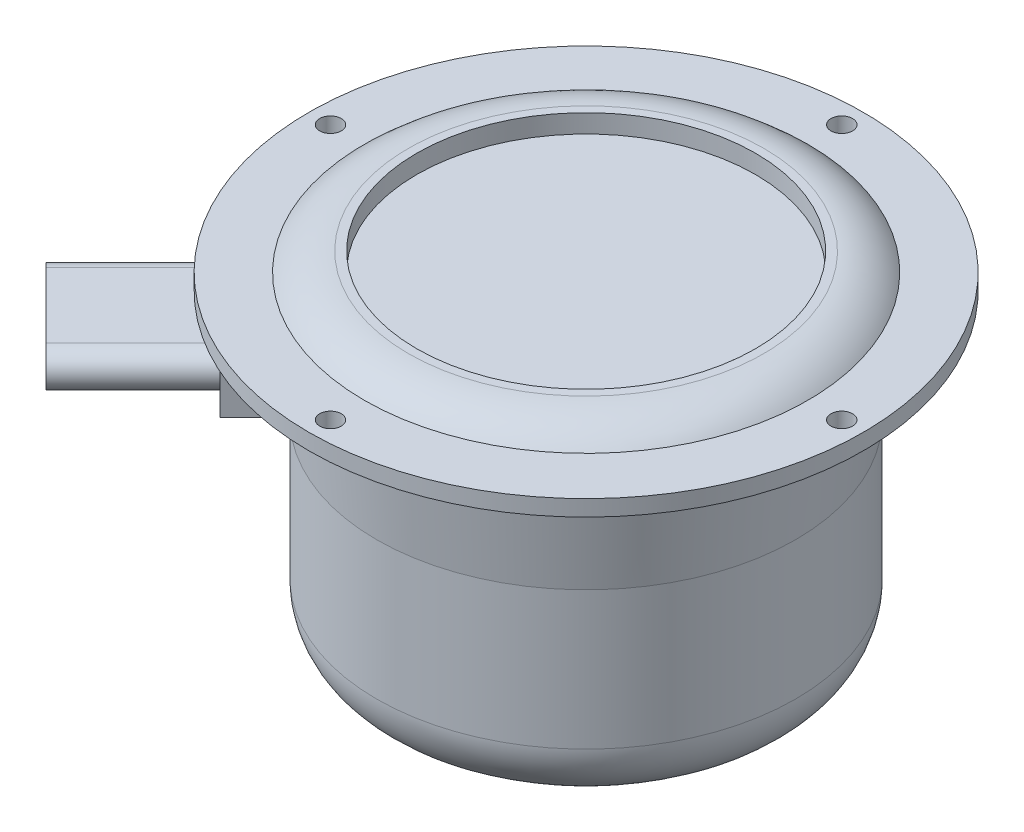
from build123d import *

# Parameters (mm, degrees)
SKETCH_1_R      = 45
SKETCH_1_R_2    = 1.75
EXTRUDE_1_DEPTH = 2.6
SKETCH_3_R      = 34
SKETCH_2_R      = 35.5
SKETCH_4_R      = 34
EXTRUDE_2_DEPTH = 32.4
FILLET_1_R      = 10
EXTRUDE_3_DEPTH = 10
EXTRUDE_4_DEPTH = 20
SKETCH_7_R      = 36
SKETCH_7_R_2    = 27.5
EXTRUDE_5_DEPTH = 3
FILLET_2_R      = 10


with BuildPart() as part:
    # 草图1 → 凸台-拉伸1 (new body)
    with BuildSketch(Plane(origin=(0, 0, 0), x_dir=(1, 0, 0), z_dir=(0, 1, 0))):
        with Locations(Location((0, 0, 0), (0, 0, 270))):
            Circle(SKETCH_1_R)
        with Locations(Location((41.5, 0, 0), (0, 0, 270))):
            Circle(SKETCH_1_R_2, mode=Mode.SUBTRACT)
        with Locations(Location((-41.5, 0, 0), (0, 0, 270))):
            Circle(SKETCH_1_R_2, mode=Mode.SUBTRACT)
        with Locations(Location((0, 41.5, 0), (0, 0, 270))):
            Circle(SKETCH_1_R_2, mode=Mode.SUBTRACT)
        with Locations(Location((0, -41.5, 0), (0, 0, 270))):
            Circle(SKETCH_1_R_2, mode=Mode.SUBTRACT)
    extrude(amount=EXTRUDE_1_DEPTH)

    # 草图3 → 放样1 section 0
    with BuildSketch(Plane(origin=(0, -18, 0), x_dir=(-1, 0, 0), z_dir=(0, -1, 0))):
        Circle(SKETCH_3_R)
    # 草图2 → 放样1 section 1
    with BuildSketch(Plane.XZ):
        Circle(SKETCH_2_R)
    loft()

    # 草图4 → 凸台-拉伸2 (add)
    with BuildSketch(Plane.XZ.offset(18)):
        with Locations(Location((0, 0, 0), (0, 0, 270))):
            Circle(SKETCH_4_R)
    extrude(amount=EXTRUDE_2_DEPTH)

    # 圆角1
    fillet_1_edges = [part.edges().sort_by_distance(p)[0] for p in [
        (0, -50.4, 34),
    ]]
    fillet(fillet_1_edges, radius=FILLET_1_R)

    # 草图5 → 凸台-拉伸3 (add)
    with BuildSketch(Plane.XZ):
        Polygon((-17.67766953, 33.234018716), (-33.234018716, 17.67766953), (-37.476659403, 21.920310217), (-21.920310217, 37.476659403), align=None)
    extrude(amount=EXTRUDE_3_DEPTH)

    # 草图6 → 凸台-拉伸4 (add)
    with BuildSketch(Plane(origin=(-29.69848481, 0, 29.69848481), x_dir=(0.7071067811865436, 0, 0.7071067811865515), z_dir=(-0.7071067811865515, 0, 0.7071067811865436))):
        with BuildLine():
            Line((-7.5, -2), (7.5, -2))
            ThreePointArc((7.5, -2), (10.5, -5), (7.5, -8))
            Line((7.5, -8), (-7.5, -8))
            ThreePointArc((-7.5, -8), (-10.5, -5), (-7.5, -2))
        make_face()
    extrude(amount=EXTRUDE_4_DEPTH)

    # 草图7 → 凸台-拉伸5 (add)
    with BuildSketch(Plane(origin=(0, 2.6, 0), x_dir=(1, 0, 0), z_dir=(0, 1, 0))):
        with Locations(Location((0, 0, 0), (0, 0, 270))):
            Circle(SKETCH_7_R)
        with Locations(Location((0, 0, 0), (0, 0, 270))):
            Circle(SKETCH_7_R_2, mode=Mode.SUBTRACT)
    extrude(amount=EXTRUDE_5_DEPTH)

    # 圆角2
    # the kernel refuses this fillet: 10 mm, written as the material it takes off along each edge
    with BuildSketch(Plane(origin=(0, 5.6, 0), x_dir=(0, 0, 1), z_dir=(-1, 0, 0))) as fillet_2_piece_1:
        with BuildLine():
            CenterArc((28.858571571, -10), FILLET_2_R, 44.427004001, 45.572995999)
            Line((28.858571571, 0), (28.858571571, 0.2))
            Line((28.858571571, 0.2), (36, 0.2))
            Line((36, 0.2), (36.2, 0))
            ThreePointArc((36.2, 0), (36.2, -1.5), (36.142828569, -2.86))
            Line((36.142828569, -2.86), (36, -3))
        make_face()
    revolve(axis=Axis((0, 5.6, 0), (0, 1, 0)), mode=Mode.SUBTRACT)


solid = part.part
